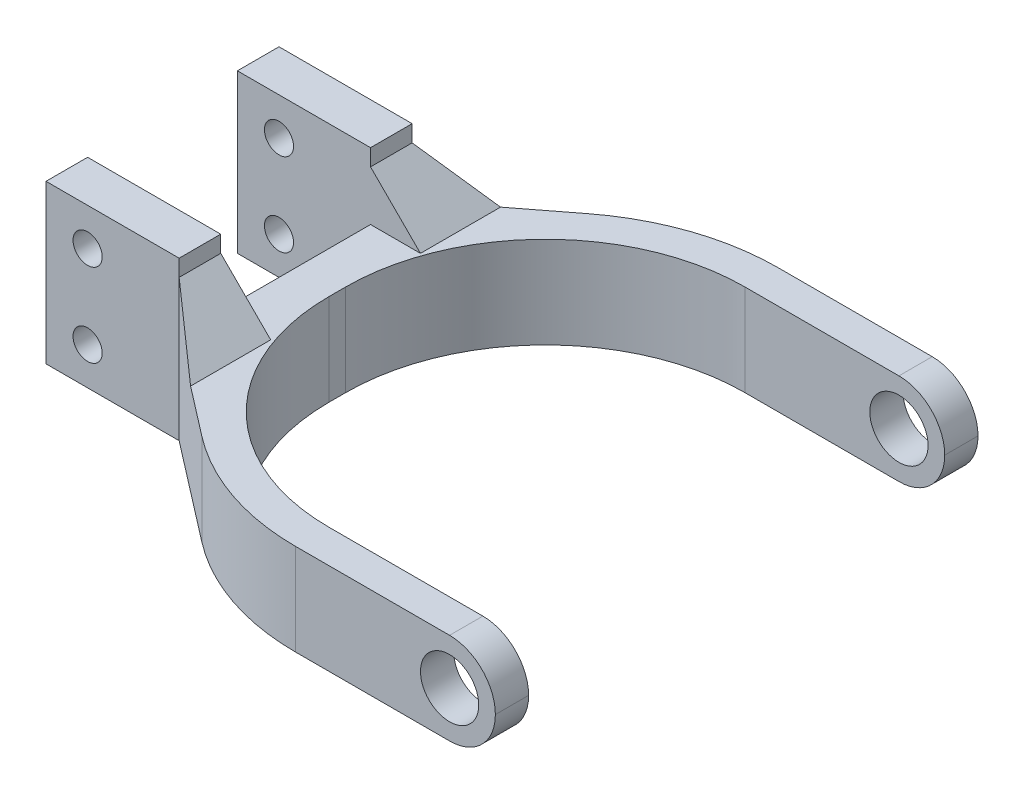
from build123d import *

# Parameters (mm, degrees)
BOSS_EXTRUDE1_DEPTH = 5.5
FILLET1_R           = 5.5
SKETCH2_R           = 3.5
CUT_EXTRUDE1_DEPTH  = 79.760713557
SKETCH3_W           = 16
SKETCH3_H           = 5
BOSS_EXTRUDE2_DEPTH = 8
SKETCH4_R           = 1.75
CUT_EXTRUDE2_DEPTH  = 70.571905249
CHAMFER1_SIZE       = 6


# Some blends are built 0.0001 mm under size
with BuildPart() as part:
    # Sketch1 → Boss-Extrude1 (new, symmetric)
    with BuildSketch(Plane(origin=(0, 0, 0), x_dir=(1, 0, 0), z_dir=(0, 1, 0))):
        with BuildLine():
            Line((-16, 9), (-16, 14))
            Line((-16, 14), (0, 14))
            Line((0, 14), (11.907049388, 23.177264019))
            ThreePointArc((11.907049388, 23.177264019), (19.971251264, 27.504371267), (29, 29))
            Line((29, 29), (53, 29))
            Line((53, 29), (53, 25))
            Line((53, 25), (29, 25))
            ThreePointArc((29, 25), (12.029437252, 17.970562748), (5, 1))
            Line((5, 1), (5, -1))
            ThreePointArc((5, -1), (12.029437252, -17.970562748), (29, -25))
            Line((29, -25), (53, -25))
            Line((53, -25), (53, -29))
            Line((53, -29), (29, -29))
            ThreePointArc((29, -29), (19.971251264, -27.504371267), (11.907049388, -23.177264019))
            Line((11.907049388, -23.177264019), (0, -14))
            Line((0, -14), (-16, -14))
            Line((-16, -14), (-16, -9))
            Line((-16, -9), (0, -9))
            Line((0, -9), (0, 9))
            Line((0, 9), (-16, 9))
        make_face()
    extrude(amount=BOSS_EXTRUDE1_DEPTH, both=True)

    # Fillet1
    fillet1_edges = [part.edges().sort_by_distance(p)[0] for p in [
        (53, -5.5, 27),
        (53, 5.5, 27),
        (53, -5.5, -27),
        (53, 5.5, -27),
    ]]
    fillet(fillet1_edges, radius=FILLET1_R - 0.0001)  # a hair under: the kernel refuses the full size

    # Sketch2 → Cut-Extrude1 (cut, through all)
    with BuildSketch(Plane.XY.offset(29)):
        with Locations((47.5, 0)):
            Circle(SKETCH2_R)
    extrude(amount=-CUT_EXTRUDE1_DEPTH, mode=Mode.SUBTRACT)

    # Sketch3 → Boss-Extrude2 (add)
    with BuildSketch(Plane(origin=(0, 5.5, 0), x_dir=(1, 0, 0), z_dir=(0, 1, 0))):
        with Locations((-8, 11.5)):
            Rectangle(SKETCH3_W, SKETCH3_H)
        with Locations((-8, -11.5)):
            Rectangle(SKETCH3_W, SKETCH3_H)
    extrude(amount=BOSS_EXTRUDE2_DEPTH)

    # Sketch4 → Cut-Extrude2 (cut, through all)
    with BuildSketch(Plane.XY.offset(14)):
        with Locations((-11, 9)):
            Circle(SKETCH4_R)
        with Locations((-11, -1)):
            Circle(SKETCH4_R)
    extrude(amount=-CUT_EXTRUDE2_DEPTH, mode=Mode.SUBTRACT)

    # Chamfer1
    # the kernel refuses this chamfer: 6 mm, written as the material it adds along each edge
    with BuildSketch(Plane(origin=(0, 5.5, -29.430097928), x_dir=(0.9996219169112968, -0.027495876610586348, 0), z_dir=(0, 0, 1))) as chamfer1_piece_1_section:
        Polygon((CHAMFER1_SIZE * 0.999621916911, CHAMFER1_SIZE * 0.0274958766106), (-CHAMFER1_SIZE * 0.0274958766106, CHAMFER1_SIZE * 0.999621916911), (0, 0), align=None)
    chamfer1_piece_1 = extrude(amount=20.430097928, mode=Mode.PRIVATE)
    chamfer1_piece_1 = split(chamfer1_piece_1, bisect_by=Plane(origin=(4.348037064, 5.828125, -17.351215133), z_dir=(0.6104625218625276, 0, 0.7920451435374395)), keep=Keep.TOP, mode=Mode.PRIVATE)
    add(chamfer1_piece_1)
    with BuildSketch(Plane(origin=(0, 5.5, 9), x_dir=(0.9996219169112968, -0.027495876610586348, 0), z_dir=(0, 0, 1))) as chamfer1_piece_2_section:
        Polygon((CHAMFER1_SIZE * 0.999621916911, CHAMFER1_SIZE * 0.0274958766106), (-CHAMFER1_SIZE * 0.0274958766106, CHAMFER1_SIZE * 0.999621916911), (0, 0), align=None)
    chamfer1_piece_2 = extrude(amount=20.430097928, mode=Mode.PRIVATE)
    chamfer1_piece_2 = split(chamfer1_piece_2, bisect_by=Plane(origin=(-0.01385991, 7.547619048, 13.989317584), z_dir=(0.6104625218625275, 0, -0.7920451435374395)), keep=Keep.TOP, mode=Mode.PRIVATE)
    add(chamfer1_piece_2)


solid = part.part
